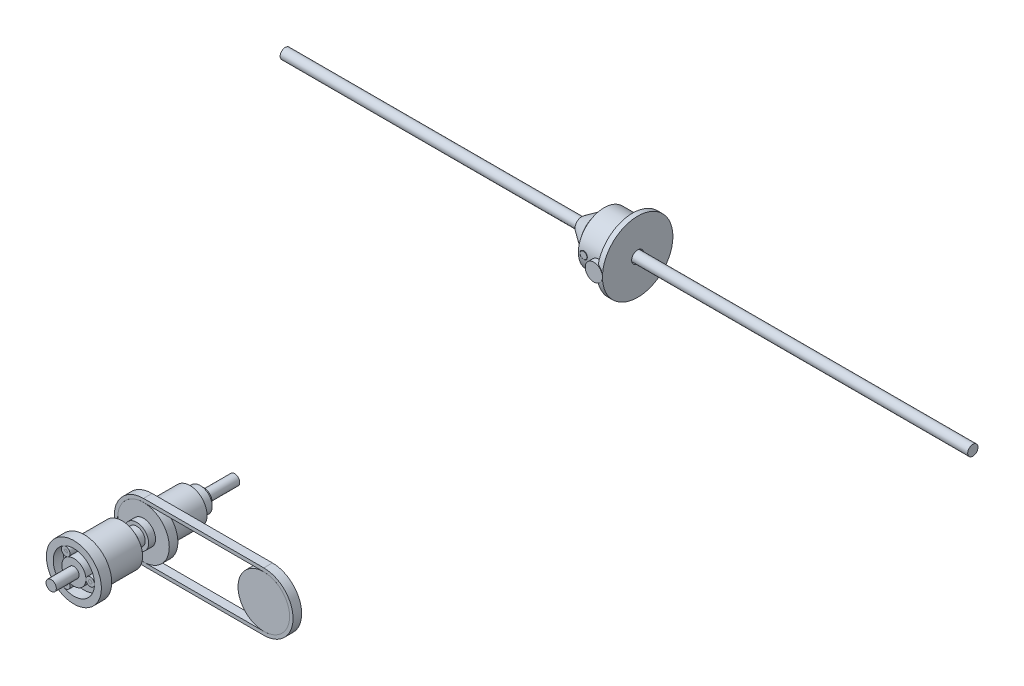
from build123d import *

# Parameters (mm, degrees)
REAR_DIFFERENTIAL_PINION_PROFILE_R                = 2.5
REAR_DIFFERENTIAL_PINION_DEPTH                    = 1.5
REAR_DIFFERENTIAL_RING_GEAR_PROFILE_R             = 10.25
REAR_DIFFERENTIAL_RING_GEAR_DEPTH                 = 1.5
RD_OUTER_L_GEAR_PROFILE_R                         = 3.5
RD_OUTER_L_GEAR_EXTRUDE_DEPTH                     = 1.5
RD_INNER_L_GEAR_PROFILE_R                         = 3.5
RD_INNER_L_GEAR_EXTRUDE_DEPTH                     = 1.5
RD_OUTER_S_GEAR_PROFILE_R                         = 3
RD_OUTER_S_GEAR_EXTRUDE_DEPTH                     = 1.5
RD_INNER_S_GEAR_PROFILE_R                         = 3
RD_INNER_S_GEAR_EXTRUDE_DEPTH                     = 1.5
RD_RING_GEAR_CASE_PROFILE_R                       = 7.5
RD_RING_GEAR_CASE_DEPTH                           = 8.25
SKETCH11_R                                        = 5.5
SKETCH11_R_2                                      = 4.75
BOSS_EXTRUDE8_DEPTH                               = 1.5
FILLET1_R                                         = 2
SKETCH13_R                                        = 1.75
CUT_EXTRUDE1_DEPTH                                = 137.607787113
SKETCH14_R                                        = 1
BOSS_EXTRUDE9_DEPTH                               = 4
CUT_EXTRUDE2_DEPTH                                = 22.981526335
CUT_EXTRUDE2_DEPTH_BACK                           = 22.981526335
SKETCH15_R                                        = 1.1
BOSS_EXTRUDE10_START                              = -7
SKETCH14_2_R                                      = 1
BOSS_EXTRUDE10_DEPTH                              = 4
SKETCH16_R                                        = 1.5
BOSS_EXTRUDE11_DEPTH                              = 91.25
SKETCH17_R                                        = 1.5
BOSS_EXTRUDE12_DEPTH                              = 102.75
FWD_SPROCKETS_DEPTH                               = 1.25
FWD_SPROCKETS_DEPTH_BACK                          = 1.25
SKETCH19_R                                        = 7.5
FWD_SPROCKETS_2_DEPTH                             = 1.25
FWD_SPROCKETS_2_DEPTH_BACK                        = 1.25
FWD_SPROCKET_CHAIN_REACH                          = 182.776
FWD_SPROCKET_CHAIN_DIRECTION_2_REACH              = 182.776
BOSS_EXTRUDE15_START                              = 1
SKETCH21_R                                        = 2.5
BOSS_EXTRUDE15_DEPTH                              = 1
SKETCH22_R                                        = 3.5
SKETCH22_R_2                                      = 2.5
MODE_SLEEVE_GEAR_DEPTH                            = 2
SKETCH23_R                                        = 2.5
BOSS_EXTRUDE17_DEPTH                              = 1.75
SKETCH24_R                                        = 2.5
MAIN_SHAFT_RANGE_SLEEVE_GEAR_DEPTH                = 5
SKETCH25_R                                        = 6
SKETCH25_R_2                                      = 4.5
CARRIER_RANGE_SLEEVE_GEAR_DEPTH                   = 1.5
SKETCH27_R                                        = 2.5
INPUT_RANGE_SLEEVE_GEAR_DEPTH                     = 1.5
SKETCH28_R                                        = 4.5
SKETCH28_R_2                                      = 2.5
RANGE_SLEEVE_SLEEVE_GEAR_DEPTH                    = 3
SKETCH29_R                                        = 3.5
PLANETARY_SUN_GEAR_DEPTH                          = 3
SKETCH30_R                                        = 1.25
PLANETARY_PLANET_GEAR_DEPTH                       = 3
PLANETARY_PLANET_GEAR_X_3_COUNT                   = 3
SKETCH31_R                                        = 8
SKETCH31_R_2                                      = 6
PLANETARY_RING_GEAR_DEPTH                         = 3
SKETCH32_R                                        = 6
SKETCH32_R_2                                      = 0.5
CARRIER_DEPTH                                     = 1
SKETCH32_3_R                                      = 0.5
CARRIER_SHAFTS_DEPTH                              = 3
SKETCH33_R                                        = 6
SKETCH33_R_2                                      = 5.5
CARRIER_RANGE_SLEEVE_GEAR_CONNECT_DEPTH           = 9.5
SKETCH34_R                                        = 3.5
CENTER_DIFF_MAIN_SHAFT_SIDE_GEAR_DEPTH            = 1.5
SKETCH35_R                                        = 3
CENTER_DIFF_RIGHT_PINION_DEPTH                    = 1.5
SKETCH36_R                                        = 3
CENTER_DIFF_LEFT_PINION_DEPTH                     = 1.5
SKETCH37_R                                        = 5
CENTER_DIFF_REAR_AXLE_SIDE_PLATE_DEPTH            = 2
SKETCH38_R                                        = 5
CENTER_DIFF_CASE_DEPTH                            = 8
SKETCH39_R                                        = 2.5
CENTER_DIFF_LOCK_GEAR_DEPTH                       = 1
SKETCH41_R                                        = 3.5
SKETCH41_R_2                                      = 2.5
LOCK_SLEEVE_DEPTH                                 = 2.5
LOCK_SLEEVE_REAR_SHAFT_GEAR_DEPTH                 = 1
LOCK_SLEEVE_REAR_SHAFT_GEAR_DEPTH_BACK            = 1
SKETCH42_R                                        = 2.5
CENTER_DIFF_PINION_ROTATION_POINT_CUT_DEPTH       = 170.710415119
CENTER_DIFF_PINION_ROTATION_POINT_CUT_DEPTH_BACK  = 170.710415119
SKETCH43_R                                        = 0.5
CENTER_DIFF_SIDE_GEAR_ROTATION_POINT_DEPTH        = 171.730965264
CENTER_DIFF_SIDE_GEAR_ROTATION_POINT_DEPTH_BACK   = 171.730965264
SKETCH45_R                                        = 0.5
REAR_SHAFT_DEPTH                                  = 1
REAR_SHAFT_DEPTH_BACK                             = 10
SKETCH46_R                                        = 1.5
CENTER_DIFF_REAR_SHAFT_SIDE_AXLE_DEPTH            = 3.5
CENTER_DIFF_REAR_SHAFT_SIDE_AXLE_DEPTH_BACK       = 1
SKETCH47_R                                        = 0.5
SKETCH48_R                                        = 0.5
CENTER_DIFF_RIGHT_SIDE_PINION_AXLE_DEPTH          = 3
SKETCH49_R                                        = 0.5
CENTER_DIFF_LEFT_SIDE_PINION_AXLE_DEPTH           = 3
MAIN_SHAFT_SPROCKET_ROTATION_POINT_CUT_DEPTH      = 184.486545828
MAIN_SHAFT_SPROCKET_ROTATION_POINT_CUT_DEPTH_BACK = 184.486545828
SKETCH50_R                                        = 0.5
MAIN_SHAFT_DEPTH                                  = 9.25
MAIN_SHAFT_DEPTH_BACK                             = 9
SKETCH50_2_R                                      = 0.5
INPUT_SHAFT_CARRIER_CUT_DEPTH                     = 200.005339124
INPUT_SHAFT_CARRIER_CUT_DEPTH_BACK                = 200.005339124
SKETCH52_R                                        = 1.5
INPUT_SHAFT_DEPTH                                 = 6.612909
INPUT_SHAFT_DEPTH_BACK                            = 8.5
SKETCH52_2_R                                      = 1.5


with BuildPart() as part:
    # Rear Differential Pinion Profile → Rear Differential Pinion (new body)
    with BuildSketch(Plane.XY.offset(-114.75)):
        Circle(REAR_DIFFERENTIAL_PINION_PROFILE_R)
    extrude(amount=-REAR_DIFFERENTIAL_PINION_DEPTH)


with BuildPart() as body_2:
    # Rear Differential Ring Gear Profile → Rear Differential Ring Gear (new body)
    with BuildSketch(Plane(origin=(2.5, 0, 0), x_dir=(0, 0, -1), z_dir=(1, 0, 0))):
        with Locations((125, 0)):
            Circle(REAR_DIFFERENTIAL_RING_GEAR_PROFILE_R)
    extrude(amount=-REAR_DIFFERENTIAL_RING_GEAR_DEPTH)

    # RD Ring Gear Case Profile → RD Ring Gear Case (add)
    with BuildSketch(Plane.ZY.offset(-1)):
        with Locations(Location((-125, 0, 0), (0, 0, 180))):
            Circle(RD_RING_GEAR_CASE_PROFILE_R)
        with BuildLine():
            Line((-121.5, 3.211308145), (-121.5, -3.211308145))
            ThreePointArc((-121.5, -3.211308145), (-125, -4.75), (-128.5, -3.211308145))
            Line((-128.5, -3.211308145), (-128.5, 3.211308145))
            ThreePointArc((-128.5, 3.211308145), (-125, 4.75), (-121.5, 3.211308145))
        make_face(mode=Mode.SUBTRACT)
    extrude(amount=RD_RING_GEAR_CASE_DEPTH)

    # Sketch11 → Boss-Extrude8 (add)
    with BuildSketch(Plane.ZY.offset(7.25)):
        with Locations((-125, 0)):
            Circle(SKETCH11_R)
        with Locations(Location((-125, 0, 0), (0, 0, 222.536898363))):
            Circle(SKETCH11_R_2, mode=Mode.SUBTRACT)
    extrude(amount=BOSS_EXTRUDE8_DEPTH)

    # Fillet1
    # the kernel refuses this fillet: 2 mm, written as the material it adds along each edge
    with BuildSketch(Plane(origin=(-7.25, 0, -125), x_dir=(0, 0, 1), z_dir=(0, -1, 0))) as fillet1_piece_1:
        with BuildLine():
            CenterArc((7.436491673, 2), FILLET1_R, 194.477512186, 75.522487814)
            Line((5.5, 1.5), (5.461270167, 1.49))
            ThreePointArc((5.461270167, 1.49), (5.46, 0.75), (5.46, 0))
            Line((5.46, 0), (5.5, -0.04))
            Line((5.5, -0.04), (7.436491673, -0.04))
            Line((7.436491673, -0.04), (7.436491673, 0))
        make_face()
    revolve(axis=Axis((-7.25, 0, -125), (-1, 0, 0)))

    # Sketch12 → Revolve1 (revolve)
    with BuildSketch(Plane.XY.offset(-125)):
        Polygon((-13.75, 0), (-13.75, 2), (-8.75, 5.5), (-8.75, 0), align=None)
    revolve(axis=Axis((-8.75, 0, -125), (-1, 0, 0)))

    # Sketch13 → Cut-Extrude1 (cut, through all)
    with BuildSketch(Plane(origin=(2.5, 0, 0), x_dir=(0, 0, -1), z_dir=(1, 0, 0))):
        with Locations((125, 0)):
            Circle(SKETCH13_R)
    extrude(amount=-CUT_EXTRUDE1_DEPTH, mode=Mode.SUBTRACT)

    # Sketch15 → Cut-Extrude2 (cut, two sides: drawn at the far end of the back side and taken through both)
    with BuildSketch(Plane.XY.offset(-121.5).offset(-CUT_EXTRUDE2_DEPTH_BACK)):
        with Locations((-5.75, 0)):
            Circle(SKETCH15_R)
    extrude(amount=CUT_EXTRUDE2_DEPTH + CUT_EXTRUDE2_DEPTH_BACK, mode=Mode.SUBTRACT)


with BuildPart() as body_3:
    # RD Outer L Gear Profile → RD Outer L Gear Extrude (new body)
    with BuildSketch(Plane(origin=(-8.75, 0, 0), x_dir=(0, 0, -1), z_dir=(1, 0, 0))):
        with Locations((125, 0)):
            Circle(RD_OUTER_L_GEAR_PROFILE_R)
    extrude(amount=RD_OUTER_L_GEAR_EXTRUDE_DEPTH)

    # Sketch16 → Boss-Extrude11 (add)
    with BuildSketch(Plane.ZY.offset(8.75)):
        with Locations((-125, 0)):
            Circle(SKETCH16_R)
    extrude(amount=BOSS_EXTRUDE11_DEPTH)


with BuildPart() as body_4:
    # RD Inner L Gear Profile → RD Inner L Gear Extrude (new body)
    with BuildSketch(Plane(origin=(-2.75, 0, 0), x_dir=(0, 0, -1), z_dir=(1, 0, 0))):
        with Locations((125, 0)):
            Circle(RD_INNER_L_GEAR_PROFILE_R)
    extrude(amount=-RD_INNER_L_GEAR_EXTRUDE_DEPTH)

    # Sketch17 → Boss-Extrude12 (add)
    with BuildSketch(Plane(origin=(-2.75, 0, 0), x_dir=(0, 0, -1), z_dir=(1, 0, 0))):
        with Locations((125, 0)):
            Circle(SKETCH17_R)
    extrude(amount=BOSS_EXTRUDE12_DEPTH)


with BuildPart() as body_5:
    # RD Outer S Gear Profile → RD Outer S Gear Extrude (new body)
    with BuildSketch(Plane.XY.offset(-128.5)):
        with Locations((-5.75, 0)):
            Circle(RD_OUTER_S_GEAR_PROFILE_R)
    extrude(amount=RD_OUTER_S_GEAR_EXTRUDE_DEPTH)

    # Sketch14<2> → Boss-Extrude10 (add)
    with BuildSketch(Plane.XY.offset(-121.5).offset(BOSS_EXTRUDE10_START)):
        with Locations((-5.75, 0)):
            Circle(SKETCH14_2_R)
    extrude(amount=-BOSS_EXTRUDE10_DEPTH)


with BuildPart() as body_6:
    # RD Inner S Gear Profile → RD Inner S Gear Extrude (new body)
    with BuildSketch(Plane.XY.offset(-121.5)):
        with Locations((-5.75, 0)):
            Circle(RD_INNER_S_GEAR_PROFILE_R)
    extrude(amount=-RD_INNER_S_GEAR_EXTRUDE_DEPTH)

    # Sketch14 → Boss-Extrude9 (add)
    with BuildSketch(Plane.XY.offset(-121.5)):
        with Locations((-5.75, 0)):
            Circle(SKETCH14_R)
    extrude(amount=BOSS_EXTRUDE9_DEPTH)


with BuildPart() as body_7:
    # Sketch19 → FWD Sprockets (new, two sides: drawn at the far end of the back side and taken through both)
    with BuildSketch(Plane.XY.offset(15).offset(-FWD_SPROCKETS_DEPTH_BACK)):
        with Locations((35, 0)):
            Circle(SKETCH19_R)
    extrude(amount=FWD_SPROCKETS_DEPTH + FWD_SPROCKETS_DEPTH_BACK)


with BuildPart() as body_8:
    # Sketch19 → FWD Sprockets 2 (new, two sides: drawn at the far end of the back side and taken through both)
    with BuildSketch(Plane.XY.offset(15).offset(-FWD_SPROCKETS_2_DEPTH_BACK)):
        Circle(SKETCH19_R)
    extrude(amount=FWD_SPROCKETS_2_DEPTH + FWD_SPROCKETS_2_DEPTH_BACK)


with BuildPart() as body_9:

    # FWD Sprocket Chain: up to this face of the body (flat: up to its plane)
    fwd_sprocket_chain_end = Plane(body_8.part.faces().sort_by_distance((0, 0, 16.25))[0])
    # Sketch20 → FWD Sprocket Chain (new, up to the picked face)
    with BuildSketch(Plane.XY.offset(15), mode=Mode.PRIVATE) as fwd_sprocket_chain_sk1:
        with BuildLine():
            Line((0, 8.5), (35, 8.5))
            ThreePointArc((35, 8.5), (43.5, 0), (35, -8.5))
            Line((35, -8.5), (0, -8.5))
            ThreePointArc((0, -8.5), (-8.5, 0), (0, 8.5))
        make_face()
        with BuildLine():
            Line((0, 7.5), (35, 7.5))
            ThreePointArc((35, 7.5), (42.5, 0), (35, -7.5))
            Line((35, -7.5), (0, -7.5))
            ThreePointArc((0, -7.5), (-7.5, 0), (0, 7.5))
        make_face(mode=Mode.SUBTRACT)
    fwd_sprocket_chain_tool1 = split(extrude(fwd_sprocket_chain_sk1.sketch, amount=FWD_SPROCKET_CHAIN_REACH, mode=Mode.PRIVATE), bisect_by=fwd_sprocket_chain_end, keep=Keep.BOTH, mode=Mode.PRIVATE)
    add(fwd_sprocket_chain_tool1.solids().sort_by(Axis((17.5, -7.952917, 15), (0, 0, 1)))[0])


    # FWD Sprocket Chain direction 2: up to this face of the body (flat: up to its plane)
    fwd_sprocket_chain_direction_2_end = Plane(body_8.part.faces().sort_by_distance((0, 0, 13.75))[0])
    # Sketch20 → FWD Sprocket Chain direction 2 (add, up to the picked face)
    with BuildSketch(Plane.XY.offset(15), mode=Mode.PRIVATE) as fwd_sprocket_chain_direction_2_sk1:
        with BuildLine():
            Line((0, 8.5), (35, 8.5))
            ThreePointArc((35, 8.5), (43.5, 0), (35, -8.5))
            Line((35, -8.5), (0, -8.5))
            ThreePointArc((0, -8.5), (-8.5, 0), (0, 8.5))
        make_face()
        with BuildLine():
            Line((0, 7.5), (35, 7.5))
            ThreePointArc((35, 7.5), (42.5, 0), (35, -7.5))
            Line((35, -7.5), (0, -7.5))
            ThreePointArc((0, -7.5), (-7.5, 0), (0, 7.5))
        make_face(mode=Mode.SUBTRACT)
    fwd_sprocket_chain_direction_2_tool1 = split(extrude(fwd_sprocket_chain_direction_2_sk1.sketch, amount=-FWD_SPROCKET_CHAIN_DIRECTION_2_REACH, mode=Mode.PRIVATE), bisect_by=fwd_sprocket_chain_direction_2_end, keep=Keep.BOTH, mode=Mode.PRIVATE)
    add(fwd_sprocket_chain_direction_2_tool1.solids().sort_by(Axis((17.5, -7.952917, 15), (0, 0, -1)))[0])


with BuildPart() as body_8_1:
    add(body_8.part)

    # Sketch21 → Boss-Extrude15 (add)
    with BuildSketch(Plane.XY.offset(16.25).offset(BOSS_EXTRUDE15_START)):
        Circle(SKETCH21_R)
    extrude(amount=-BOSS_EXTRUDE15_DEPTH)

    # Sketch50 → Main Shaft Sprocket Rotation Point Cut (cut, two sides: drawn at the far end of the back side and taken through both)
    with BuildSketch(Plane.XY.offset(18.25).offset(-MAIN_SHAFT_SPROCKET_ROTATION_POINT_CUT_DEPTH_BACK)):
        Circle(SKETCH50_R)
    extrude(amount=MAIN_SHAFT_SPROCKET_ROTATION_POINT_CUT_DEPTH + MAIN_SHAFT_SPROCKET_ROTATION_POINT_CUT_DEPTH_BACK, mode=Mode.SUBTRACT)


with BuildPart() as body_10:
    # Sketch22 → Mode Sleeve Gear (new body)
    with BuildSketch(Plane.XY.offset(18.25)):
        Circle(SKETCH22_R)
        Circle(SKETCH22_R_2, mode=Mode.SUBTRACT)
    extrude(amount=-MODE_SLEEVE_GEAR_DEPTH)


with BuildPart() as body_11:
    # Sketch23 → Boss-Extrude17 (new body)
    with BuildSketch(Plane.XY.offset(18.25)):
        Circle(SKETCH23_R)
    extrude(amount=BOSS_EXTRUDE17_DEPTH)


with BuildPart() as body_12:
    # Sketch24 → Main Shaft Range Sleeve Gear (new body)
    with BuildSketch(Plane.XY.offset(22.5)):
        Circle(SKETCH24_R)
    extrude(amount=MAIN_SHAFT_RANGE_SLEEVE_GEAR_DEPTH)


with BuildPart() as body_13:
    # Sketch25 → Carrier Range Sleeve Gear (new body)
    with BuildSketch(Plane.XY.offset(22.5)):
        Circle(SKETCH25_R)
        Circle(SKETCH25_R_2, mode=Mode.SUBTRACT)
    extrude(amount=CARRIER_RANGE_SLEEVE_GEAR_DEPTH)



with BuildPart() as body_14:
    # Sketch27 → Input Range Sleeve Gear (new body)
    with BuildSketch(Plane.XY.offset(29.5)):
        Circle(SKETCH27_R)
    extrude(amount=-INPUT_RANGE_SLEEVE_GEAR_DEPTH)


with BuildPart() as body_15:
    # Sketch28 → Range Sleeve Sleeve Gear (new body)
    with BuildSketch(Plane.XY.offset(29.5)):
        Circle(SKETCH28_R)
        Circle(SKETCH28_R_2, mode=Mode.SUBTRACT)
    extrude(amount=-RANGE_SLEEVE_SLEEVE_GEAR_DEPTH)


with BuildPart() as body_16:
    # Sketch29 → Planetary Sun Gear (new body)
    with BuildSketch(Plane.XY.offset(36.5)):
        Circle(SKETCH29_R)
    extrude(amount=-PLANETARY_SUN_GEAR_DEPTH)


    add(body_14.part)  # Input Shaft merges body 14
    # Sketch52<2> → Input Shaft (add, two sides: drawn at the far end of the back side and taken through both)
    with BuildSketch(Plane.XY.offset(36.5).offset(-INPUT_SHAFT_DEPTH_BACK)):
        Circle(SKETCH52_2_R)
    extrude(amount=INPUT_SHAFT_DEPTH + INPUT_SHAFT_DEPTH_BACK)


with BuildPart() as body_17:
    # Sketch30 → Planetary Planet Gear (new body)
    with BuildSketch(Plane.XY.offset(36.5)):
        with Locations((4.75, 0)):
            Circle(SKETCH30_R)
    extrude(amount=-PLANETARY_PLANET_GEAR_DEPTH)


with BuildPart() as planetary_planet_gear_x_3_1:
    # Planetary Planet Gear x 3: pattern copy
    add(body_17.part.rotate(Axis((0, 0, 0), (0, 0, 1)), 1 * 360 / PLANETARY_PLANET_GEAR_X_3_COUNT))


with BuildPart() as planetary_planet_gear_x_3_2:
    # Planetary Planet Gear x 3: pattern copy
    add(body_17.part.rotate(Axis((0, 0, 0), (0, 0, 1)), 2 * 360 / PLANETARY_PLANET_GEAR_X_3_COUNT))


with BuildPart() as body_20:
    # Sketch31 → Planetary Ring Gear (new body)
    with BuildSketch(Plane.XY.offset(36.5)):
        Circle(SKETCH31_R)
        Circle(SKETCH31_R_2, mode=Mode.SUBTRACT)
    extrude(amount=-PLANETARY_RING_GEAR_DEPTH)


with BuildPart() as body_21:
    # Sketch32 → Carrier (new body)
    # profile 1 of 4: a face of its own
    with BuildSketch(Plane.XY.offset(33.5)):
        Circle(SKETCH32_R)
        with Locations((-2.375, 4.113620668)):
            Circle(SKETCH32_R_2, mode=Mode.SUBTRACT)
        with Locations((-2.375, -4.113620668)):
            Circle(SKETCH32_R_2, mode=Mode.SUBTRACT)
        with Locations((4.75, 0)):
            Circle(SKETCH32_R_2, mode=Mode.SUBTRACT)
    # profile 2 of 4: a face of its own
    with BuildSketch(Plane.XY.offset(33.5)):
        with Locations((-2.375, 4.113620668)):
            Circle(SKETCH32_R_2)
    # profile 3 of 4: a face of its own
    with BuildSketch(Plane.XY.offset(33.5)):
        with Locations((4.75, 0)):
            Circle(SKETCH32_R_2)
    # profile 4 of 4: a face of its own
    with BuildSketch(Plane.XY.offset(33.5)):
        with Locations((-2.375, -4.113620668)):
            Circle(SKETCH32_R_2)
    extrude(amount=-CARRIER_DEPTH)

    # Sketch32<3> → Carrier Shafts (add)
    with BuildSketch(Plane.XY.offset(33.5)):
        with Locations((4.75, 0)):
            Circle(SKETCH32_3_R)
        with Locations((-2.375, -4.113620668)):
            Circle(SKETCH32_3_R)
        with Locations((-2.375, 4.113620668)):
            Circle(SKETCH32_3_R)
    extrude(amount=CARRIER_SHAFTS_DEPTH)


with BuildPart() as body_13_1:
    add(body_13.part)

    add(body_21.part)  # Carrier Range Sleeve Gear Connect merges body 21
    # Sketch33 → Carrier Range Sleeve Gear Connect (add)
    with BuildSketch(Plane.XY.offset(33.5)):
        Circle(SKETCH33_R)
        Circle(SKETCH33_R_2, mode=Mode.SUBTRACT)
    extrude(amount=-CARRIER_RANGE_SLEEVE_GEAR_CONNECT_DEPTH)

    # Sketch52 → Input Shaft Carrier Cut (cut, two sides: drawn at the far end of the back side and taken through both)
    with BuildSketch(Plane.XY.offset(36.5).offset(-INPUT_SHAFT_CARRIER_CUT_DEPTH_BACK)):
        Circle(SKETCH52_R)
    extrude(amount=INPUT_SHAFT_CARRIER_CUT_DEPTH + INPUT_SHAFT_CARRIER_CUT_DEPTH_BACK, mode=Mode.SUBTRACT)


with BuildPart() as body_21_2:
    # Sketch34 → Center Diff Main Shaft Side Gear (new body)
    with BuildSketch(Plane.XY.offset(10.75)):
        Circle(SKETCH34_R)
    extrude(amount=-CENTER_DIFF_MAIN_SHAFT_SIDE_GEAR_DEPTH)


with BuildPart() as body_22:
    # Center Diff Rear Shaft Side Gear: mirrored copy
    add(body_21_2.part.mirror(Plane.XY.offset(7.75)))


with BuildPart() as body_23:
    # Sketch35 → Center Diff Right Pinion (new body)
    with BuildSketch(Plane.ZY.offset(2)):
        with Locations((7.75, 0)):
            Circle(SKETCH35_R)
    extrude(amount=CENTER_DIFF_RIGHT_PINION_DEPTH)


with BuildPart() as body_24:
    # Sketch36 → Center Diff Left Pinion (new body)
    with BuildSketch(Plane.ZY.offset(-2)):
        with Locations((7.75, 0)):
            Circle(SKETCH36_R)
    extrude(amount=-CENTER_DIFF_LEFT_PINION_DEPTH)


with BuildPart() as body_25:
    # Sketch37 → Center Diff Rear Axle Side Plate (new body)
    with BuildSketch(Plane.XY.offset(2.75)):
        Circle(SKETCH37_R)
    extrude(amount=CENTER_DIFF_REAR_AXLE_SIDE_PLATE_DEPTH)


with BuildPart() as body_26:
    # Center Diff Main Shaft Side Plate: mirrored copy
    add(body_25.part.mirror(Plane.XY.offset(7.75)))


    add(body_25.part)  # Center Diff Case merges body 25
    # Sketch38 → Center Diff Case (add)
    with BuildSketch(Plane.XY.offset(2.75)):
        Circle(SKETCH38_R)
        with BuildLine():
            ThreePointArc((-3.5, -2.828427125), (0, -4.5), (3.5, -2.828427125))
            Line((3.5, -2.828427125), (3.5, 2.828427125))
            ThreePointArc((3.5, 2.828427125), (0, 4.5), (-3.5, 2.828427125))
            Line((-3.5, 2.828427125), (-3.5, -2.828427125))
        make_face(mode=Mode.SUBTRACT)
    extrude(amount=CENTER_DIFF_CASE_DEPTH)

    # Sketch39 → Center Diff Lock Gear (add)
    with BuildSketch(Plane.XY.offset(2.75)):
        Circle(SKETCH39_R)
    extrude(amount=-CENTER_DIFF_LOCK_GEAR_DEPTH)


with BuildPart() as body_26_2:
    # Sketch41 → Lock Sleeve (new body)
    with BuildSketch(Plane.XY.offset(-0.25)):
        Circle(SKETCH41_R)
        Circle(SKETCH41_R_2, mode=Mode.SUBTRACT)
    extrude(amount=LOCK_SLEEVE_DEPTH)


with BuildPart() as body_27:
    # Sketch42 → Lock Sleeve Rear Shaft Gear (new, two sides: drawn at the far end of the back side and taken through both)
    with BuildSketch(Plane.XY.offset(-0.25).offset(-LOCK_SLEEVE_REAR_SHAFT_GEAR_DEPTH_BACK)):
        Circle(SKETCH42_R)
    extrude(amount=LOCK_SLEEVE_REAR_SHAFT_GEAR_DEPTH + LOCK_SLEEVE_REAR_SHAFT_GEAR_DEPTH_BACK)

    # Sketch46 → Rear Shaft (add, two sides: drawn at the far end of the back side and taken through both)
    with BuildSketch(Plane.XY.offset(-0.25).offset(-REAR_SHAFT_DEPTH_BACK)):
        Circle(SKETCH46_R)
    extrude(amount=REAR_SHAFT_DEPTH + REAR_SHAFT_DEPTH_BACK)


with BuildPart() as center_diff_pinion_rotation_point_cut_tool:
    # Sketch43 → Center Diff Pinion Rotation Point Cut (new, two sides: drawn at the far end of the back side and taken through both)
    with BuildSketch(Plane.ZY.offset(2).offset(-CENTER_DIFF_PINION_ROTATION_POINT_CUT_DEPTH_BACK)):
        with Locations((7.75, 0)):
            Circle(SKETCH43_R)
    extrude(amount=CENTER_DIFF_PINION_ROTATION_POINT_CUT_DEPTH + CENTER_DIFF_PINION_ROTATION_POINT_CUT_DEPTH_BACK)


with BuildPart() as body_23_1:
    add(body_23.part)

    # Center Diff Pinion Rotation Point Cut: cut by center_diff_pinion_rotation_point_cut_tool
    add(center_diff_pinion_rotation_point_cut_tool.part, mode=Mode.SUBTRACT)

    # Sketch48 → Center Diff Right Side Pinion Axle (add)
    with BuildSketch(Plane.ZY.offset(2)):
        with Locations((7.75, 0)):
            Circle(SKETCH48_R)
    extrude(amount=CENTER_DIFF_RIGHT_SIDE_PINION_AXLE_DEPTH)


with BuildPart() as body_24_1:
    add(body_24.part)

    # Center Diff Pinion Rotation Point Cut: cut by center_diff_pinion_rotation_point_cut_tool
    add(center_diff_pinion_rotation_point_cut_tool.part, mode=Mode.SUBTRACT)

    # Sketch49 → Center Diff Left Side Pinion Axle (add)
    with BuildSketch(Plane.ZY.offset(-2)):
        with Locations((7.75, 0)):
            Circle(SKETCH49_R)
    extrude(amount=-CENTER_DIFF_LEFT_SIDE_PINION_AXLE_DEPTH)


with BuildPart() as body_26_1:
    add(body_26.part)

    # Center Diff Pinion Rotation Point Cut: cut by center_diff_pinion_rotation_point_cut_tool
    add(center_diff_pinion_rotation_point_cut_tool.part, mode=Mode.SUBTRACT)


with BuildPart() as center_diff_side_gear_rotation_point_tool:
    # Sketch45 → Center Diff Side Gear Rotation Point (new, two sides: drawn at the far end of the back side and taken through both)
    with BuildSketch(Plane.XY.offset(2.75).offset(-CENTER_DIFF_SIDE_GEAR_ROTATION_POINT_DEPTH_BACK)):
        Circle(SKETCH45_R)
    extrude(amount=CENTER_DIFF_SIDE_GEAR_ROTATION_POINT_DEPTH + CENTER_DIFF_SIDE_GEAR_ROTATION_POINT_DEPTH_BACK)


with BuildPart() as body_26_3:
    add(body_26_1.part)

    # Center Diff Side Gear Rotation Point: cut by center_diff_side_gear_rotation_point_tool
    add(center_diff_side_gear_rotation_point_tool.part, mode=Mode.SUBTRACT)


with BuildPart() as body_22_1:
    add(body_22.part)

    # Center Diff Side Gear Rotation Point: cut by center_diff_side_gear_rotation_point_tool
    add(center_diff_side_gear_rotation_point_tool.part, mode=Mode.SUBTRACT)

    # Sketch47 → Center Diff Rear Shaft Side Axle (add, two sides: drawn at the far end of the back side and taken through both)
    with BuildSketch(Plane.XY.offset(2.75).offset(-CENTER_DIFF_REAR_SHAFT_SIDE_AXLE_DEPTH_BACK)):
        Circle(SKETCH47_R)
    extrude(amount=CENTER_DIFF_REAR_SHAFT_SIDE_AXLE_DEPTH + CENTER_DIFF_REAR_SHAFT_SIDE_AXLE_DEPTH_BACK)


with BuildPart() as body_21_2_1:
    add(body_21_2.part)

    # Center Diff Side Gear Rotation Point: cut by center_diff_side_gear_rotation_point_tool
    add(center_diff_side_gear_rotation_point_tool.part, mode=Mode.SUBTRACT)


    add(body_11.part)  # Main Shaft merges body 11

    add(body_12.part)  # Main Shaft merges body 12
    # Sketch50<2> → Main Shaft (add, two sides: drawn at the far end of the back side and taken through both)
    with BuildSketch(Plane.XY.offset(18.25).offset(-MAIN_SHAFT_DEPTH_BACK)):
        Circle(SKETCH50_2_R)
    extrude(amount=MAIN_SHAFT_DEPTH + MAIN_SHAFT_DEPTH_BACK)


solid = Compound([part.part, body_2.part, body_3.part, body_4.part, body_5.part, body_6.part, body_7.part, body_9.part, body_8_1.part, body_10.part, body_15.part, body_16.part, body_17.part, planetary_planet_gear_x_3_1.part, planetary_planet_gear_x_3_2.part, body_20.part, body_13_1.part, body_26_2.part, body_27.part, body_23_1.part, body_24_1.part, body_26_3.part, body_22_1.part, body_21_2_1.part])
